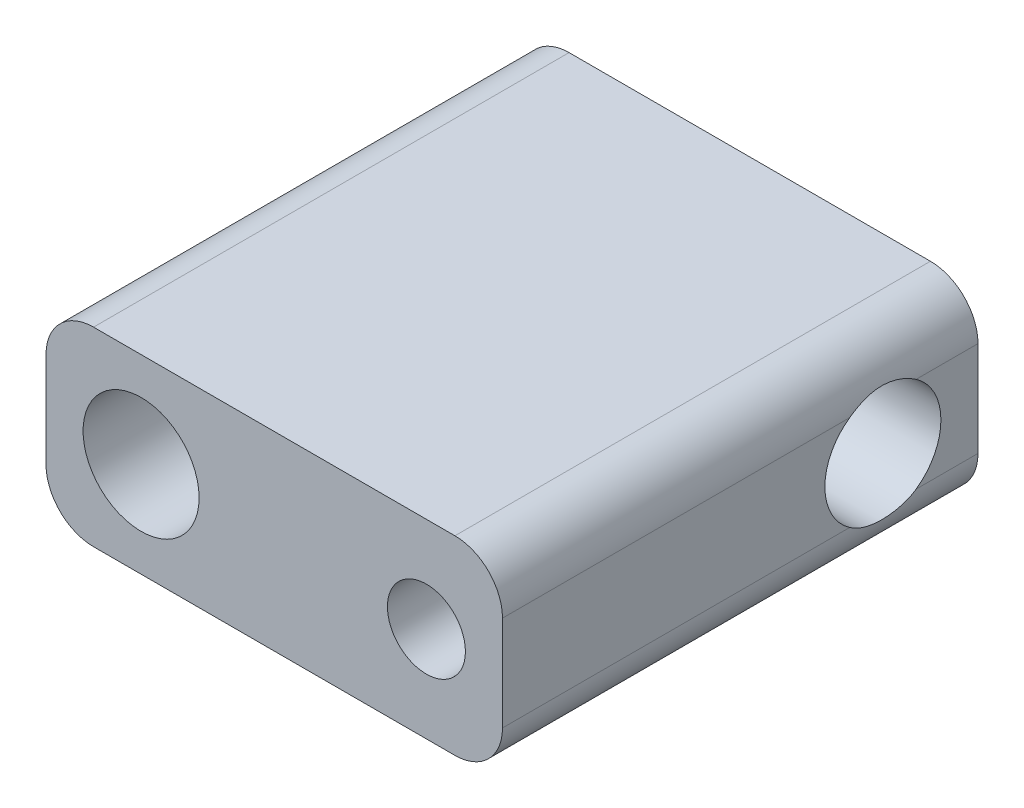
from build123d import *

# Parameters (mm, degrees)
SKETCH1_W           = 48
SKETCH1_H           = 20
SKETCH1_R           = 6.1
SKETCH1_R_2         = 4.1
BOSS_EXTRUDE1_DEPTH = 30
SKETCH2_W           = 48
SKETCH2_H           = 20
BOSS_EXTRUDE2_DEPTH = 20
SKETCH3_R           = 6.1
CUT_EXTRUDE1_DEPTH  = 40
FILLET1_R           = 5


with BuildPart() as part:
    # Sketch1 → Boss-Extrude1 (new body)
    with BuildSketch(Plane.XY):
        Rectangle(SKETCH1_W, SKETCH1_H)
        with Locations((-14, 0)):
            Circle(SKETCH1_R, mode=Mode.SUBTRACT)
        with Locations((16, 0)):
            Circle(SKETCH1_R_2, mode=Mode.SUBTRACT)
    extrude(amount=BOSS_EXTRUDE1_DEPTH)

    # Sketch2 → Boss-Extrude2 (add)
    with BuildSketch(Plane(origin=(0, 0, 0), x_dir=(-1, 0, 0), z_dir=(0, 0, -1))):
        Rectangle(SKETCH2_W, SKETCH2_H)
    extrude(amount=BOSS_EXTRUDE2_DEPTH)

    # Sketch3 → Cut-Extrude1 (cut)
    with BuildSketch(Plane(origin=(24, 0, 0), x_dir=(0, 0, -1), z_dir=(1, 0, 0))):
        with Locations((10, 0)):
            Circle(SKETCH3_R)
    extrude(amount=-CUT_EXTRUDE1_DEPTH, mode=Mode.SUBTRACT)

    # Fillet1
    # the kernel refuses this fillet: 5 mm, written as the material it takes off along each edge
    with BuildSketch(Plane(origin=(24, -10, 42.5), x_dir=(0, 1, 0), z_dir=(0, 0, -1)), Plane(origin=(-24, -10, -32.5), x_dir=(0, 1, 0), z_dir=(0, 0, 1)), Plane(origin=(-24, 10, -32.5), x_dir=(1, 0, 0), z_dir=(0, 0, 1)), Plane(origin=(24, 10, 42.5), x_dir=(-1, 0, 0), z_dir=(0, 0, -1))) as fillet1_piece_1:
        with BuildLine():
            CenterArc((FILLET1_R, -FILLET1_R), FILLET1_R, 90, 90)
            Line((0, -FILLET1_R), (0, 0))
            Line((0, 0), (FILLET1_R, 0))
        make_face()
    extrude(amount=75, mode=Mode.SUBTRACT)


solid = part.part
